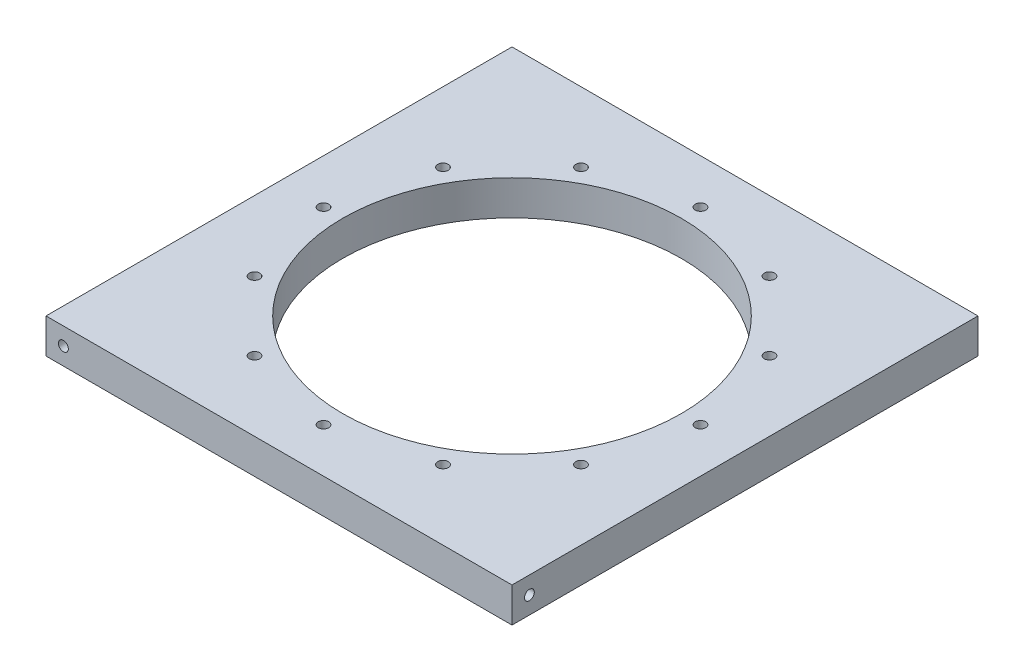
from build123d import *

# Parameters (mm, degrees)
SKETCH1_W           = 127.635
SKETCH1_H           = 127.635
BOSS_EXTRUDE1_DEPTH = 9.525
CUT_EXTRUDE1_DEPTH  = 9.525
SKETCH11_R          = 1.4351
CUT_EXTRUDE3_DEPTH  = 181.754286464
CIRPATTERN1_COUNT   = 12
SKETCH6_R           = 1.35255
F_6_32_HOLE1_DEPTH  = 12.7
SKETCH7_R           = 1.35255
F_6_32_HOLE2_DEPTH  = 12.7
SKETCH8_R           = 1.35255
F_6_32_HOLE3_DEPTH  = 12.7
SKETCH9_R           = 1.35255
F_6_32_HOLE4_DEPTH  = 12.7


with BuildPart() as part:
    # Sketch1 → Boss-Extrude1 (new body)
    with BuildSketch(Plane(origin=(0, 0, 0), x_dir=(1, 0, 0), z_dir=(0, 1, 0))):
        with Locations((63.8175, 63.8175)):
            Rectangle(SKETCH1_W, SKETCH1_H)
    extrude(amount=BOSS_EXTRUDE1_DEPTH)

    # Sketch5 → Cut-Extrude1 (cut)
    with BuildSketch(Plane(origin=(0, 9.525, 0), x_dir=(1, 0, 0), z_dir=(0, 1, 0))):
        with BuildLine():
            ThreePointArc((63.8175, 110.1725), (17.4625, 63.8175), (63.8175, 17.4625))
            Line((63.8175, 17.4625), (63.8175, 110.1725))
        make_face()
        with BuildLine():
            Line((63.8175, 110.1725), (63.8175, 17.4625))
            ThreePointArc((63.8175, 17.4625), (96.595434842, 31.039565158), (110.1725, 63.8175))
            ThreePointArc((110.1725, 63.8175), (96.595434842, 96.595434842), (63.8175, 110.1725))
        make_face()
        with BuildLine():
            ThreePointArc((63.8175, 110.1725), (17.4625, 63.8175), (63.8175, 17.4625))
            Line((63.8175, 17.4625), (63.8175, 110.1725))
        make_face()
        with BuildLine():
            Line((63.8175, 110.1725), (63.8175, 17.4625))
            ThreePointArc((63.8175, 17.4625), (96.595434842, 31.039565158), (110.1725, 63.8175))
            ThreePointArc((110.1725, 63.8175), (96.595434842, 96.595434842), (63.8175, 110.1725))
        make_face()
    extrude(amount=-CUT_EXTRUDE1_DEPTH, mode=Mode.SUBTRACT)

    # Sketch11 → Cut-Extrude3 (cut, through all)
    with BuildSketch(Plane(origin=(0, 9.525, 0), x_dir=(1, 0, 0), z_dir=(0, 1, 0))):
        with Locations((63.8175, 115.443)):
            Circle(SKETCH11_R)
    cut_extrude3 = extrude(amount=-CUT_EXTRUDE3_DEPTH, mode=Mode.SUBTRACT)

    # CirPattern1: Cut-Extrude3 ×12 about axis
    cirpattern1_axis = Axis((63.8175, 9.525, -63.8175), (0, 1, 0))
    for i in range(1, CIRPATTERN1_COUNT):
        add(cut_extrude3.rotate(cirpattern1_axis, i * 360 / CIRPATTERN1_COUNT), mode=Mode.SUBTRACT)

    # Sketch6 → 6-32 hole1 (cut)
    with BuildSketch(Plane(origin=(127.635, 0, 0), x_dir=(0, 0, -1), z_dir=(1, 0, 0))):
        with Locations((4.7625, 4.7625)):
            Circle(SKETCH6_R)
    extrude(amount=-F_6_32_HOLE1_DEPTH, mode=Mode.SUBTRACT)

    # Sketch7 → 6-32 hole2 (cut)
    with BuildSketch(Plane(origin=(0, 0, -127.635), x_dir=(-1, 0, 0), z_dir=(0, 0, -1))):
        with Locations((-122.8725, 4.7625)):
            Circle(SKETCH7_R)
    extrude(amount=-F_6_32_HOLE2_DEPTH, mode=Mode.SUBTRACT)

    # Sketch8 → 6-32 hole3 (cut)
    with BuildSketch(Plane.ZY):
        with Locations((-122.8725, 4.7625)):
            Circle(SKETCH8_R)
    extrude(amount=-F_6_32_HOLE3_DEPTH, mode=Mode.SUBTRACT)

    # Sketch9 → 6-32 hole4 (cut)
    with BuildSketch(Plane.XY):
        with Locations((4.7625, 4.7625)):
            Circle(SKETCH9_R)
    extrude(amount=-F_6_32_HOLE4_DEPTH, mode=Mode.SUBTRACT)


solid = part.part
